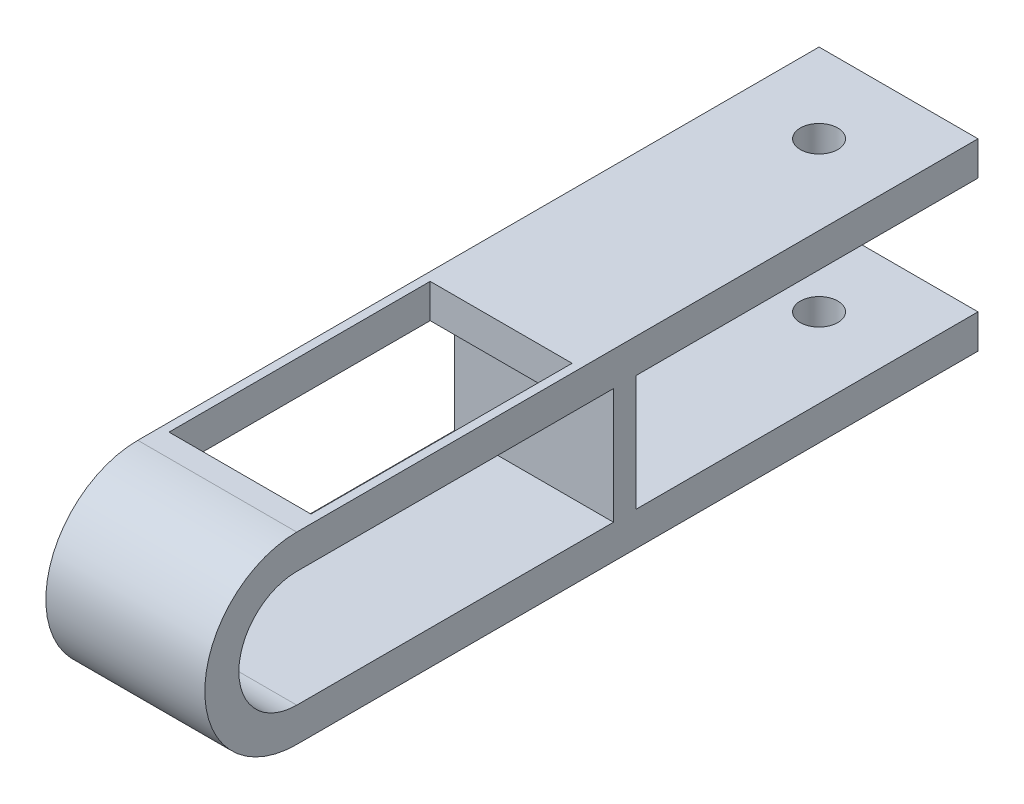
from build123d import *

# Parameters (mm, degrees)
BOSS_EXTRUDE1_DEPTH = 14
SKETCH3_R           = 1.65
CUT_EXTRUDE1_DEPTH  = 40
CUT_EXTRUDE2_DEPTH  = 1.5
SKETCH6_R           = 0.15
CUT_EXTRUDE3_DEPTH  = 0.5
SKETCH8_R           = 0.15
CUT_EXTRUDE4_DEPTH  = 0.5
CUT_EXTRUDE5_REACH  = 73.387
SKETCH9_W           = 12.5
SKETCH9_H           = 23


with BuildPart() as part:
    # Sketch2 → Boss-Extrude1 (new body)
    with BuildSketch(Plane.YZ):
        with BuildLine():
            Line((8.1, 0), (5.1, 0))
            Line((5.1, 0), (5.1, 30.1))
            Line((5.1, 30.1), (-5.1, 30.1))
            Line((-5.1, 30.1), (-5.1, 0))
            Line((-5.1, 0), (-8.1, 0))
            Line((-8.1, 0), (-8.1, 60))
            ThreePointArc((-8.1, 60), (0, 68.1), (8.1, 60))
            Line((8.1, 60), (8.1, 0))
        make_face()
        with BuildLine():
            Line((-5.1, 60), (-5.1, 32.1))
            Line((-5.1, 32.1), (5.1, 32.1))
            Line((5.1, 32.1), (5.1, 60))
            ThreePointArc((5.1, 60), (0, 65.1), (-5.1, 60))
        make_face(mode=Mode.SUBTRACT)
    extrude(amount=BOSS_EXTRUDE1_DEPTH)

    # Sketch3 → Cut-Extrude1 (cut)
    with BuildSketch(Plane.XZ.offset(8.1)):
        with Locations((7, 7)):
            Circle(SKETCH3_R)
    extrude(amount=-CUT_EXTRUDE1_DEPTH, mode=Mode.SUBTRACT)

    # Sketch4 → Cut-Extrude2 (cut)
    with BuildSketch(Plane.XZ.offset(8.1)):
        with BuildLine():
            ThreePointArc((10.6, 53), (7, 56.6), (3.4, 53))
            Line((3.4, 53), (4.65, 38))
            ThreePointArc((4.65, 38), (7, 35.65), (9.35, 38))
            Line((9.35, 38), (10.6, 53))
        make_face()
    extrude(amount=-CUT_EXTRUDE2_DEPTH, mode=Mode.SUBTRACT)

    # Sketch6 → Cut-Extrude3 (cut)
    with BuildSketch(Plane.XZ.offset(6.6)):
        with Locations((7, 38)):
            Circle(SKETCH6_R)
    extrude(amount=-CUT_EXTRUDE3_DEPTH, mode=Mode.SUBTRACT)

    # Sketch8 → Cut-Extrude4 (cut)
    with BuildSketch(Plane.XZ.offset(6.6)):
        with Locations((7, 53)):
            Circle(SKETCH8_R)
    extrude(amount=-CUT_EXTRUDE4_DEPTH, mode=Mode.SUBTRACT)

    # Sketch9 → Cut-Extrude5 (cut, up to next)
    with BuildSketch(Plane(origin=(0, 8.1, 0), x_dir=(-1, 0, 0), z_dir=(0, 1, 0)), mode=Mode.PRIVATE) as cut_extrude5_sk1:
        with Locations((-7, 46.5)):
            Rectangle(SKETCH9_W, SKETCH9_H)
    cut_extrude5_tool1 = extrude(cut_extrude5_sk1.sketch, amount=-CUT_EXTRUDE5_REACH, mode=Mode.PRIVATE) & part.part
    add(cut_extrude5_tool1.solids().sort_by_distance((7, 8.1, 46.5))[0], mode=Mode.SUBTRACT)


solid = part.part
